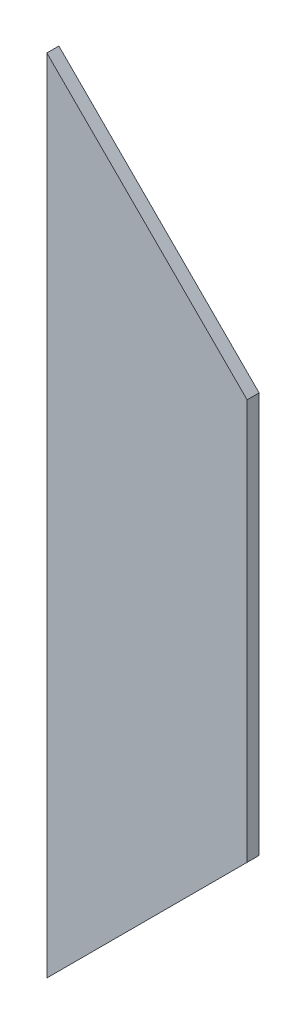
from build123d import *

# Parameters (mm, degrees)
EXTRUDE_1_DEPTH = 3


with BuildPart() as part:
    # Эскиз1 → Бобышка-Вытянуть1 (new body)
    with BuildSketch(Plane.XY):
        Polygon((0, 0), (0, 200), (50, 150), (50, 50), align=None)
    extrude(amount=EXTRUDE_1_DEPTH)


solid = part.part
